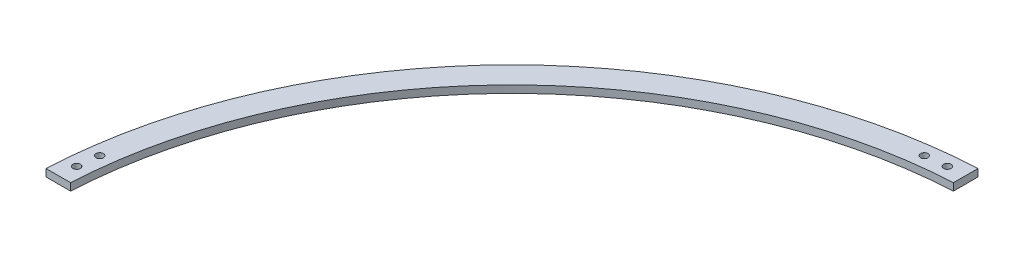
from build123d import *

# Parameters (mm, degrees)
BASE_DEPTH               = 1.5
F_3_0_3_DIAMETER_HOLE3_D = 3


with BuildPart() as part:
    # Sketch1 → base (new, symmetric)
    with BuildSketch(Plane(origin=(0, 0, 0), x_dir=(1, 0, 0), z_dir=(0, 1, 0))):
        with BuildLine():
            Line((-10, 189.73665961), (-10, 199.749843554))
            ThreePointArc((-10, 199.749843554), (-141.421356237, 141.421356237), (-199.749843554, 10))
            Line((-199.749843554, 10), (-189.73665961, 10))
            ThreePointArc((-189.73665961, 10), (-134.350288425, 134.350288425), (-10, 189.73665961))
        make_face()
    extrude(amount=BASE_DEPTH, both=True)

    # Ø3.0 (3) Diameter Hole3 (through all)
    with Locations(Plane(origin=(0, 1.5, 0), x_dir=(1, 0, 0), z_dir=(0, 1, 0))):
        with Locations((-194.257966128, 16.995369836), (-193.331747968, 25.452607483), (-25.452607483, 193.331747968), (-16.995369836, 194.257966128)):
            Hole(F_3_0_3_DIAMETER_HOLE3_D / 2)


solid = part.part
